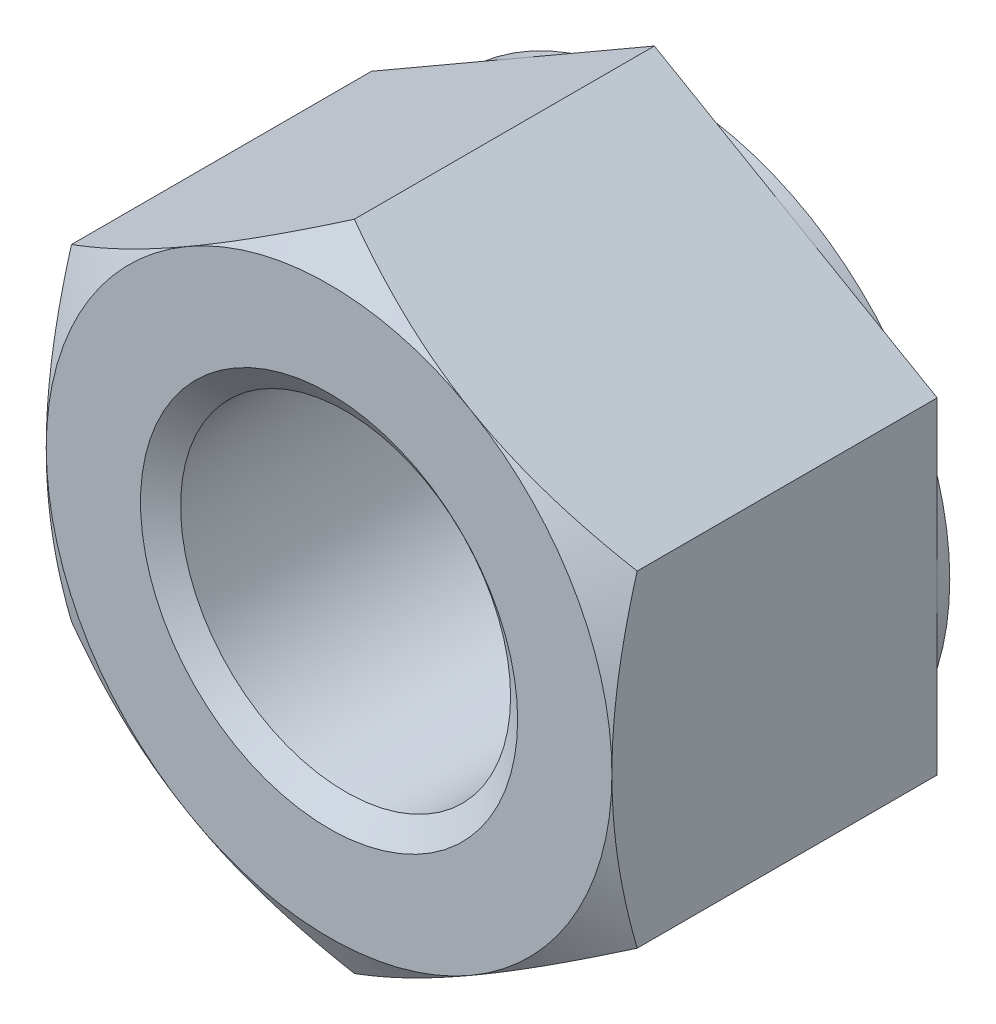
from build123d import *

# Parameters (mm, degrees)
BASENUTSKE_R  = 10.5
BASENUT_DEPTH = 21.5
SKETCH4_W     = 0.8
SKETCH4_H     = 12.784609691


with BuildPart() as part:
    # BaseNutSke → BaseNut (new body)
    with BuildSketch(Plane.XY):
        Polygon((18, 10.392304845), (18, -10.392304845), (0, -20.784609691), (-18, -10.392304845), (-18, 10.392304845), (0, 20.784609691), align=None)
        Circle(BASENUTSKE_R, mode=Mode.SUBTRACT)
    extrude(amount=-BASENUT_DEPTH)

    # Sketch4 → Bearing-Face (revolve, cut)
    with BuildSketch(Plane(origin=(0, 0, 0), x_dir=(0, 0, -1), z_dir=(1, 0, 0))):
        with Locations((21.1, 24.392304845)):
            Rectangle(SKETCH4_W, SKETCH4_H)
        Polygon((0, 18), (-10, 18), (-10, 30.784609691), (1.607695155, 30.784609691), (1.607695155, 20.784609691), align=None)
    revolve(axis=Axis((0, 0, 0), (0, 0, -1)), mode=Mode.SUBTRACT)

    # Sketch5 → EndChamfer (revolve, cut)
    with BuildSketch(Plane(origin=(0, 0, 0), x_dir=(0, 0, -1), z_dir=(1, 0, 0))):
        Polygon((21.5, 12), (20.449688693, 10.5), (21.5, 10.5), align=None)
        Polygon((0, 12), (1.050311307, 10.5), (0, 10.5), align=None)
    revolve(axis=Axis((0, 0, -22.606682842), (0, 0, -1)), mode=Mode.SUBTRACT)


solid = part.part
